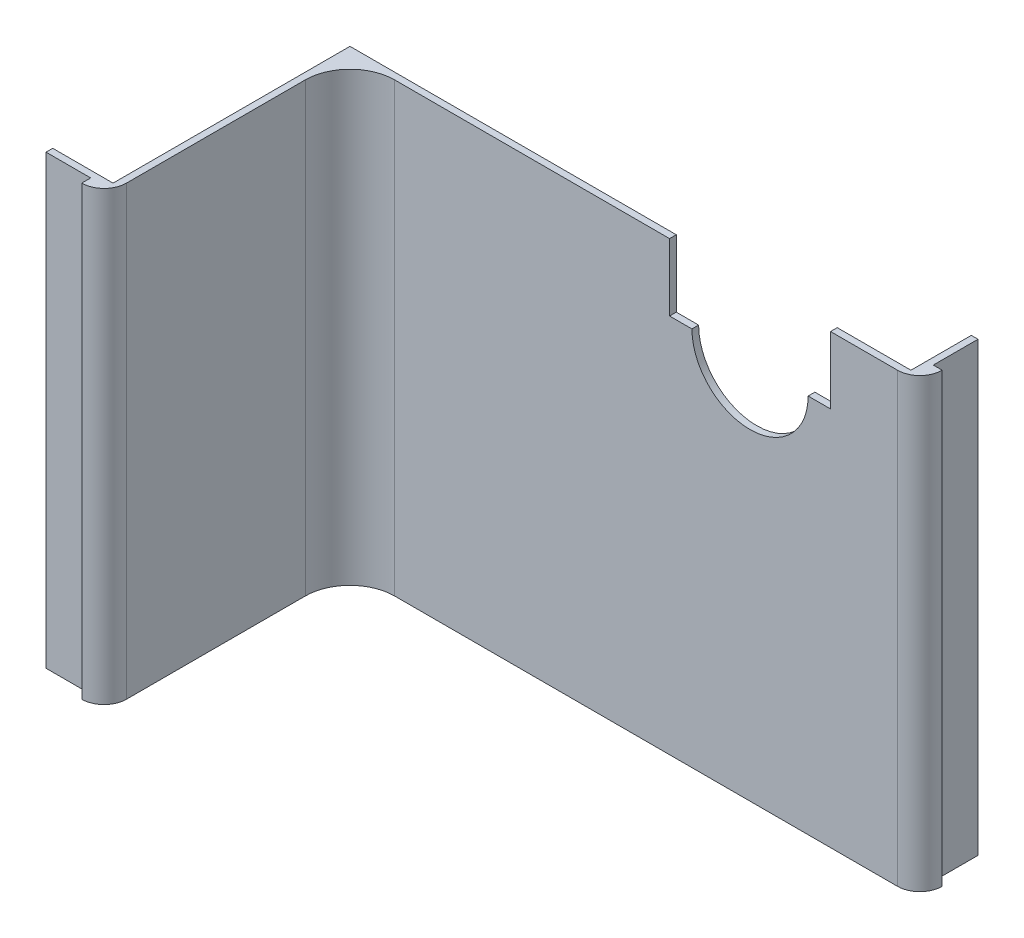
from build123d import *

# Parameters (mm, degrees)
EXTRUDE_1_DEPTH     = 100
CUT_EXTRUDE_1_DEPTH = 179.693172785


with BuildPart() as part:
    # Эскиз1 → Бобышка-Вытянуть1 (new body)
    with BuildSketch(Plane(origin=(0, 0, 0), x_dir=(1, 0, 0), z_dir=(0, 1, 0))):
        with BuildLine():
            Line((0, 0), (-112.5, 0))
            ThreePointArc((-112.5, 0), (-119.571067812, -2.928932188), (-122.5, -10))
            Line((-122.5, -10), (-122.5, -50))
            ThreePointArc((-122.5, -50), (-123.964466094, -53.535533906), (-127.5, -55))
            Line((-127.5, -55), (-127.5, -53))
            Line((-127.5, -53), (-137.5, -53))
            Line((-137.5, -53), (-137.5, -51.5))
            Line((-137.5, -51.5), (-124, -51.5))
            Line((-124, -51.5), (-124, 1.5))
            Line((-124, 1.5), (1.5, 1.5))
            Line((1.5, 1.5), (1.5, 15))
            Line((1.5, 15), (3, 15))
            Line((3, 15), (3, 5))
            Line((3, 5), (5, 5))
            ThreePointArc((5, 5), (3.535533906, 1.464466094), (0, 0))
        make_face()
    extrude(amount=EXTRUDE_1_DEPTH)

    # Эскиз4 → Вырез-Вытянуть1 (cut, through all)
    with BuildSketch(Plane.XY):
        with BuildLine():
            Line((-15, 85), (-20, 85))
            ThreePointArc((-20, 85), (-33, 72), (-46, 85))
            Line((-46, 85), (-51, 85))
            Line((-51, 85), (-51, 100))
            Line((-51, 100), (-15, 100))
            Line((-15, 100), (-15, 85))
        make_face()
    extrude(amount=-CUT_EXTRUDE_1_DEPTH, mode=Mode.SUBTRACT)


solid = part.part
